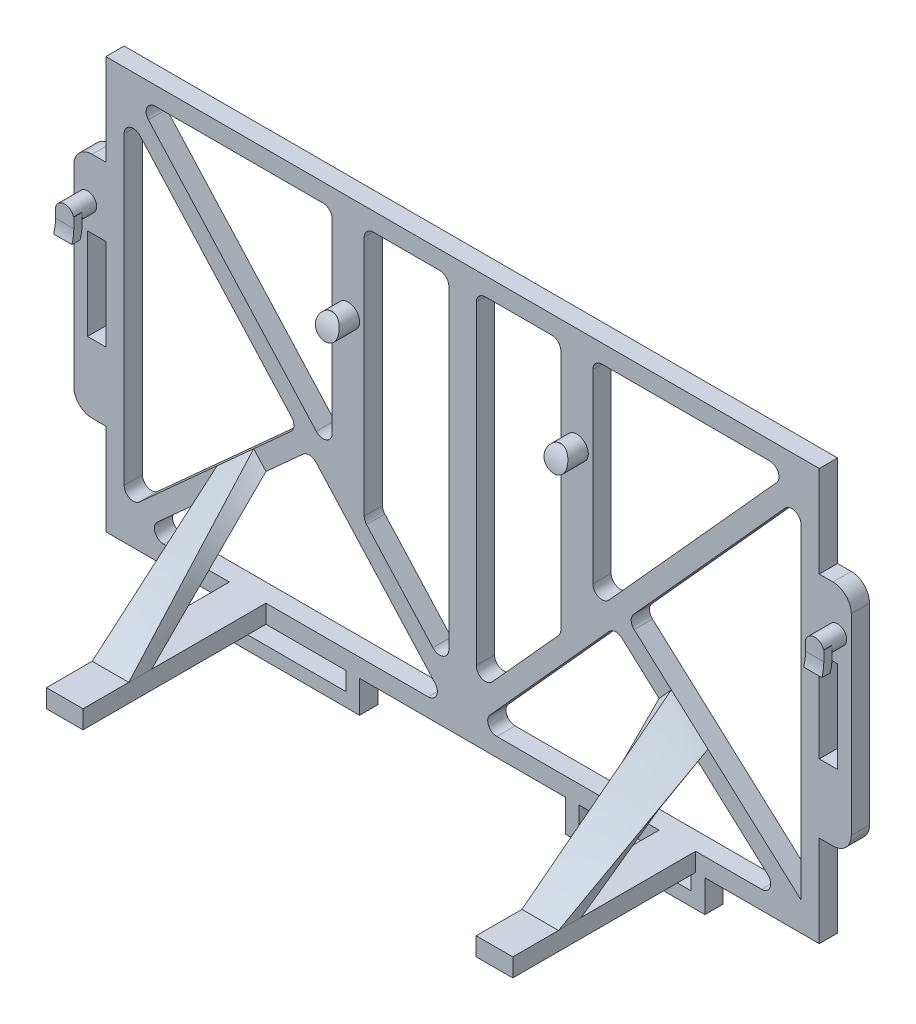
from build123d import *

# Parameters (mm, degrees)
SKETCH1_R               = 2.5
BOSS_EXTRUDE1_DEPTH     = 5
BOSS_EXTRUDE1_2_DEPTH   = 5
SKETCH1_R_2             = 2
BOSS_EXTRUDE1_3_DEPTH   = 5
BOSS_EXTRUDE1_4_DEPTH   = 5
SKETCH1_3_R             = 2.5
SKETCH1_3_R_2           = 2
SKETCH1_3_W             = 30.5
SKETCH1_3_H             = 7
BOSS_EXTRUDE2_DEPTH     = 4
SKETCH3_W               = 4
SKETCH3_H               = 1.8
BOSS_EXTRUDE4_DEPTH     = 2.5
BOSS_EXTRUDE4_2_DEPTH   = 2.5
CUT_EXTRUDE2_DEPTH      = 114.138189839
CUT_EXTRUDE2_DEPTH_BACK = 114.138189839
FILLET2_R               = 10
FILLET3_R               = 10
CUT_EXTRUDE1_DEPTH      = 185.759979433
CUT_EXTRUDE1_DEPTH_BACK = 185.759979433
BOSS_EXTRUDE6_DEPTH     = 4
FILLET4_R               = 10
CUT_EXTRUDE3_DEPTH      = 114.156572942
CUT_EXTRUDE3_DEPTH_BACK = 114.156572942
SKETCH7_W               = 24.5
SKETCH7_H               = 4
SKETCH8_W               = 8
SKETCH8_H               = 4
BOSS_EXTRUDE7_DEPTH     = 40
FILLET5_R               = 4
FILLET6_R               = 2


with BuildPart() as part:
    # Sketch1 → Boss-Extrude1 (new body)
    with BuildSketch(Plane.XY):
        with Locations((-25, 0)):
            Circle(SKETCH1_R)
    extrude(amount=BOSS_EXTRUDE1_DEPTH)


with BuildPart() as body_2:
    # Sketch1 → Boss-Extrude1 2 (new body)
    with BuildSketch(Plane.XY):
        with Locations((25, 0)):
            Circle(SKETCH1_R)
    extrude(amount=BOSS_EXTRUDE1_2_DEPTH)


with BuildPart() as body_3:
    # Sketch1 → Boss-Extrude1 3 (new body)
    with BuildSketch(Plane.XY):
        with Locations((82, -6.916)):
            Circle(SKETCH1_R_2)
    extrude(amount=BOSS_EXTRUDE1_3_DEPTH)


with BuildPart() as body_4:
    # Sketch1 → Boss-Extrude1 4 (new body)
    with BuildSketch(Plane.XY):
        with Locations((-82, -6.916)):
            Circle(SKETCH1_R_2)
    extrude(amount=BOSS_EXTRUDE1_4_DEPTH)


with BuildPart() as body_5:
    # Sketch1<3> → Boss-Extrude2 (new body)
    # profile 1 of 9: a face of its own
    with BuildSketch(Plane.XY):
        Polygon((-78, 2.5), (-78, -12.5), (-78, -32.5), (-78, -47.5), (-78, -67.5), (-53, -67.5), (-50, -67.5), (-25.5, -67.5), (-22.5, -67.5), (22.5, -67.5), (25.5, -67.5), (50, -67.5), (53, -67.5), (78, -67.5), (78, -47.5), (78, -32.5), (78, -12.5), (78, 2.5), (78, 22.5), (-78, 22.5), align=None)
        with Locations((-25, 0)):
            Circle(SKETCH1_3_R, mode=Mode.SUBTRACT)
        with Locations((25, 0)):
            Circle(SKETCH1_3_R, mode=Mode.SUBTRACT)
    # profile 2 of 9: a face of its own
    with BuildSketch(Plane.XY):
        Polygon((85, 2.5), (78, 2.5), (78, -12.5), (82, -12.5), (82, -32.5), (78, -32.5), (78, -47.5), (85, -47.5), align=None)
        with Locations((82, -6.916)):
            Circle(SKETCH1_3_R_2, mode=Mode.SUBTRACT)
    # profile 3 of 9: a face of its own
    with BuildSketch(Plane.XY):
        Polygon((-82, -32.5), (-82, -12.5), (-78, -12.5), (-78, 2.5), (-85, 2.5), (-85, -47.5), (-78, -47.5), (-78, -32.5), align=None)
        with Locations((-82, -6.916)):
            Circle(SKETCH1_3_R_2, mode=Mode.SUBTRACT)
    # profile 4 of 9: a face of its own
    with BuildSketch(Plane.XY):
        with Locations((82, -6.916)):
            Circle(SKETCH1_3_R_2)
    # profile 5 of 9: a face of its own
    with BuildSketch(Plane.XY):
        with Locations((25, 0)):
            Circle(SKETCH1_3_R)
    # profile 6 of 9: a face of its own
    with BuildSketch(Plane.XY):
        with Locations((-25, 0)):
            Circle(SKETCH1_3_R)
    # profile 7 of 9: a face of its own
    with BuildSketch(Plane.XY):
        with Locations((-82, -6.916)):
            Circle(SKETCH1_3_R_2)
    # profile 8 of 9: a face of its own
    with BuildSketch(Plane.XY):
        with Locations((-37.75, -71)):
            Rectangle(SKETCH1_3_W, SKETCH1_3_H)
    # profile 9 of 9: a face of its own
    with BuildSketch(Plane.XY):
        with Locations((37.75, -71)):
            Rectangle(SKETCH1_3_W, SKETCH1_3_H)
    extrude(amount=-BOSS_EXTRUDE2_DEPTH)


with BuildPart() as body_6:
    # Sketch3 → Boss-Extrude4 (new, symmetric)
    with BuildSketch(Plane(origin=(0, -8.916, 0), x_dir=(-1, 0, 0), z_dir=(0, -1, 0))):
        with Locations((82, -4.1)):
            Rectangle(SKETCH3_W, SKETCH3_H)
    extrude(amount=BOSS_EXTRUDE4_DEPTH, both=True)


with BuildPart() as body_7:
    # Sketch3 → Boss-Extrude4 2 (new, symmetric)
    with BuildSketch(Plane(origin=(0, -8.916, 0), x_dir=(-1, 0, 0), z_dir=(0, -1, 0))):
        with Locations((-82, -4.1)):
            Rectangle(SKETCH3_W, SKETCH3_H)
    extrude(amount=BOSS_EXTRUDE4_2_DEPTH, both=True)


with BuildPart() as cut_extrude2_tool:
    # Sketch6 → Cut-Extrude2 (new, two sides: drawn at the far end of the back side and taken through both)
    with BuildSketch(Plane(origin=(0, 0, 0), x_dir=(0, 0, -1), z_dir=(1, 0, 0)).offset(-CUT_EXTRUDE2_DEPTH_BACK)):
        Polygon((-3.5, 2.5), (-5, 0), (-5, 2.5), align=None)
    extrude(amount=CUT_EXTRUDE2_DEPTH + CUT_EXTRUDE2_DEPTH_BACK)


with BuildPart() as part_1:
    add(part.part)

    # Cut-Extrude2: cut by cut_extrude2_tool
    add(cut_extrude2_tool.part, mode=Mode.SUBTRACT)


with BuildPart() as body_2_1:
    add(body_2.part)

    # Cut-Extrude2: cut by cut_extrude2_tool
    add(cut_extrude2_tool.part, mode=Mode.SUBTRACT)

    # Fillet2
    # the kernel refuses this fillet: 10 mm, written as the material it takes off along each edge
    with BuildSketch(Plane(origin=(34.424599124, 0, 5), x_dir=(0, -1, 0), z_dir=(-1, 0, 0))) as fillet2_piece_1:
        with BuildLine():
            CenterArc((FILLET2_R * 0.276983964948, -FILLET2_R), FILLET2_R, 90, 30.963756532)
            Line((-FILLET2_R * 0.237511790479, -FILLET2_R * 0.142507074287), (0, 0))
            Line((0, 0), (FILLET2_R * 0.276983964948, 0))
        make_face()
    extrude(amount=18.849198247, mode=Mode.SUBTRACT)


with BuildPart() as body_4_1:
    add(body_4.part)

    # Combine1: union part, body 6, body 2, body 5, body 3, body 7
    add(part_1.part)
    add(body_6.part)
    add(body_2_1.part)
    add(body_5.part)
    add(body_3.part)
    add(body_7.part)

    # Fillet3
    # the kernel refuses this fillet: 10 mm, written as the material it takes off along each edge
    with BuildSketch(Plane(origin=(-15.575400876, 0, 5), x_dir=(0, 0.857492925712544, -0.5144957554275267), z_dir=(-1, 0, 0))) as fillet3_piece_1:
        with BuildLine():
            CenterArc((FILLET3_R * 0.276983964948, FILLET3_R), FILLET3_R, 239.036243468, 30.963756532)
            Line((-FILLET3_R * 0.237511790479, FILLET3_R * 0.142507074287), (0, 0))
            Line((0, 0), (FILLET3_R * 0.276983964948, 0))
        make_face()
    extrude(amount=18.849198247, mode=Mode.SUBTRACT)

    # Sketch5 → Cut-Extrude1 (cut, two sides: drawn at the far end of the back side and taken through both)
    with BuildSketch(Plane.ZY.offset(84).offset(-CUT_EXTRUDE1_DEPTH_BACK)):
        Polygon((3.6, -11.416), (3.2, -10.216), (3.2, -11.416), align=None)
    extrude(amount=CUT_EXTRUDE1_DEPTH + CUT_EXTRUDE1_DEPTH_BACK, mode=Mode.SUBTRACT)

    # Sketch5<4> → Boss-Extrude6 (add)
    with BuildSketch(Plane.ZY.offset(84)):
        Polygon((5, -10.216), (3.2, -10.216), (3.6, -11.416), (5, -11.416), align=None)
        Polygon((5.4, -11.416), (5, -10.216), (5, -11.416), align=None)
    boss_extrude6 = extrude(amount=-BOSS_EXTRUDE6_DEPTH)

    # Mirror6: Boss-Extrude6 across plane
    add(boss_extrude6.mirror(Plane(origin=(0, 0, 0), x_dir=(0, 0, 1), z_dir=(1, 0, 0))))

    # Fillet4
    # the kernel refuses this fillet: 10 mm, written as the material it adds along each edge
    with BuildSketch(Plane(origin=(-84, -10.216, 5), x_dir=(0, -0.9486832980505135, 0.31622776601683833), z_dir=(1, 0, 0))) as fillet4_piece_1_section:
        with BuildLine():
            CenterArc((1.644384383, -9.992797406), FILLET4_R, 92.174744115, 16.260204708)
            Line((-1.517893277, -0.505964426), (-1.58113883, -0.316227766))
            Line((-1.58113883, -0.316227766), (-0.063245553, 0.18973666))
            Line((-0.063245553, 0.18973666), (0, 0.2))
            ThreePointArc((0, 0.2), (0.632455532, 0.2), (1.257321598, 0.199855948))
            Line((1.257321598, 0.199855948), (1.264911064, 0))
        make_face()
    fillet4_piece_1 = extrude(amount=4, mode=Mode.PRIVATE)
    fillet4_piece_1 = split(fillet4_piece_1, bisect_by=Plane(origin=(-84, -11.416, 5), z_dir=(0, 1, 0)), keep=Keep.TOP, mode=Mode.PRIVATE)
    add(fillet4_piece_1)
    with BuildSketch(Plane(origin=(84, -10.216, 5), x_dir=(0, -0.9486832980505135, 0.31622776601683833), z_dir=(-1, 0, 0))) as fillet4_piece_2_section:
        with BuildLine():
            CenterArc((1.644384383, 9.992797406), FILLET4_R, 251.565051177, 16.260204708)
            Line((-1.517893277, 0.505964426), (-1.58113883, 0.316227766))
            Line((-1.58113883, 0.316227766), (-0.063245553, -0.18973666))
            Line((-0.063245553, -0.18973666), (0, -0.2))
            ThreePointArc((0, -0.2), (0.632455532, -0.2), (1.257321598, -0.199855948))
            Line((1.257321598, -0.199855948), (1.264911064, 0))
        make_face()
    fillet4_piece_2 = extrude(amount=4, mode=Mode.PRIVATE)
    fillet4_piece_2 = split(fillet4_piece_2, bisect_by=Plane(origin=(84, -11.416, 5), z_dir=(0, 1, 0)), keep=Keep.TOP, mode=Mode.PRIVATE)
    add(fillet4_piece_2)
    # the kernel refuses this fillet: 10 mm, written as the material it takes off along each edge
    with BuildSketch(Plane(origin=(-76, -10.216, 3.2), x_dir=(0, -0.9486832980505138, 0.31622776601683816), z_dir=(-1, 0, 0))) as fillet4_2_piece_1_section:
        with BuildLine():
            CenterArc((1.644384383, 9.992797406), FILLET4_R, 251.565051177, 16.260204708)
            Line((-1.517893277, 0.505964426), (-1.58113883, 0.316227766))
            Line((-1.58113883, 0.316227766), (-0.063245553, -0.18973666))
            Line((-0.063245553, -0.18973666), (0, -0.2))
            ThreePointArc((0, -0.2), (0.632455532, -0.2), (1.257321598, -0.199855948))
            Line((1.257321598, -0.199855948), (1.264911064, 0))
        make_face()
    fillet4_2_piece_1 = extrude(amount=12, mode=Mode.PRIVATE)
    fillet4_2_piece_1 = fillet4_2_piece_1 - Plane(origin=(-82, -6.916, 3.2), x_dir=(1, 0, 0), z_dir=(0, 0, -1)) * Cylinder(2, 31, mode=Mode.PRIVATE)
    add(fillet4_2_piece_1, mode=Mode.SUBTRACT)
    with BuildSketch(Plane(origin=(88, -10.216, 3.2), x_dir=(0, -0.9486832980505138, 0.31622776601683816), z_dir=(-1, 0, 0))) as fillet4_2_piece_2_section:
        with BuildLine():
            CenterArc((1.644384383, 9.992797406), FILLET4_R, 251.565051177, 16.260204708)
            Line((-1.517893277, 0.505964426), (-1.58113883, 0.316227766))
            Line((-1.58113883, 0.316227766), (-0.063245553, -0.18973666))
            Line((-0.063245553, -0.18973666), (0, -0.2))
            ThreePointArc((0, -0.2), (0.632455532, -0.2), (1.257321598, -0.199855948))
            Line((1.257321598, -0.199855948), (1.264911064, 0))
        make_face()
    fillet4_2_piece_2 = extrude(amount=12, mode=Mode.PRIVATE)
    fillet4_2_piece_2 = fillet4_2_piece_2 - Plane(origin=(82, -6.916, 3.2), x_dir=(1, 0, 0), z_dir=(0, 0, -1)) * Cylinder(2, 31, mode=Mode.PRIVATE)
    add(fillet4_2_piece_2, mode=Mode.SUBTRACT)

    # Sketch7 → Cut-Extrude3 (cut, two sides: drawn at the far end of the back side and taken through both)
    with BuildSketch(Plane.XY.offset(-CUT_EXTRUDE3_DEPTH_BACK)):
        Polygon((-36.055840536, -26.910896097), (-74, 15.08902799), (-74, -61.190939901), align=None)
        Polygon((-28.5, 18.5), (-71.690939901, 18.5), (-28.5, -29.307520912), align=None)
        Polygon((-3, 18.5), (-21.5, 18.5), (-21.5, -37.055734939), (-3, -57.533157725), align=None)
        Polygon((-33.37435521, -29.878999271), (-70.58902799, -63.5), (-3, -63.5), align=None)
        with Locations((-37.75, -69.5)):
            Rectangle(SKETCH7_W, SKETCH7_H)
        with Locations((37.75, -69.5)):
            Rectangle(SKETCH7_W, SKETCH7_H)
        Polygon((33.37435521, -29.878999271), (3, -63.5), (70.58902799, -63.5), align=None)
        Polygon((3, -57.533157725), (21.5, -37.055734939), (21.5, 18.5), (3, 18.5), align=None)
        Polygon((71.690939901, 18.5), (28.5, 18.5), (28.5, -29.307520912), align=None)
        Polygon((74, 15.08902799), (36.055840536, -26.910896097), (74, -61.190939901), align=None)
    extrude(amount=CUT_EXTRUDE3_DEPTH + CUT_EXTRUDE3_DEPTH_BACK, mode=Mode.SUBTRACT)

    # Sketch8 → Boss-Extrude7 (add)
    with BuildSketch(Plane.XY):
        with Locations((-46.983385512, -65.5)):
            Rectangle(SKETCH8_W, SKETCH8_H)
        with Locations((46.983385512, -65.5)):
            Rectangle(SKETCH8_W, SKETCH8_H)
    extrude(amount=BOSS_EXTRUDE7_DEPTH)

    # Loft3: read off the stored shape, not the designer's step
    # Loft3: loft between two sections, ruled curve by curve
    loft3_from = [
        Edge.make_bspline([(-50.983385512, -63.5, 30), (-49.650052179, -63.5, 30), (-48.316718845, -63.5, 30), (-45.650052179, -63.5, 30), (-44.316718845, -63.5, 30), (-42.983385512, -63.5, 30)], [0, 0, 0, 0, 0.5, 0.5, 1, 1, 1, 1], 3),
        Edge.make_bspline([(-42.983385512, -63.5, 30), (-42.983385512, -63.5, 29.166666667), (-42.983385512, -63.5, 28.333333333), (-42.983385512, -63.5, 26.666666667), (-42.983385512, -63.5, 25.833333333), (-42.983385512, -63.5, 25)], [0, 0, 0, 0, 0.5, 0.5, 1, 1, 1, 1], 3),
        Edge.make_bspline([(-50.983385512, -63.5, 25), (-50.983385512, -63.5, 25.833333333), (-50.983385512, -63.5, 26.666666667), (-50.983385512, -63.5, 28.333333333), (-50.983385512, -63.5, 29.166666667), (-50.983385512, -63.5, 30)], [0, 0, 0, 0, 0.5, 0.5, 1, 1, 1, 1], 3),
        Edge.make_bspline([(-42.983385512, -63.5, 25), (-44.316718845, -63.5, 25), (-45.650052179, -63.5, 25), (-48.316718845, -63.5, 25), (-49.650052179, -63.5, 25), (-50.983385512, -63.5, 25)], [0, 0, 0, 0, 0.5, 0.5, 1, 1, 1, 1], 3),
    ]
    loft3_to = [
        Edge.make_bspline([(-53.664870838, -42.819492798, 0), (-52.331537504, -41.61491413, 0), (-50.998204171, -40.410335462, 0), (-48.331537504, -38.001178126, 0), (-46.998204171, -36.796599458, 0), (-45.664870838, -35.59202079, 0)], [0, 0, 0, 0, 0.5, 0.5, 1, 1, 1, 1], 3),
        Edge.make_bspline([(-45.664870838, -35.59202079, 0), (-45.217956617, -36.086704652, 0), (-44.771042396, -36.581388514, 0), (-43.877213954, -37.570756239, 0), (-43.430299733, -38.065440101, 0), (-42.983385512, -38.560123963, 0)], [0, 0, 0, 0, 0.5, 0.5, 1, 1, 1, 1], 3),
        Edge.make_bspline([(-50.983385512, -45.787595972, 0), (-51.430299733, -45.29291211, 0), (-51.877213954, -44.798228247, 0), (-52.771042396, -43.808860523, 0), (-53.217956617, -43.314176661, 0), (-53.664870838, -42.819492798, 0)], [0, 0, 0, 0, 0.5, 0.5, 1, 1, 1, 1], 3),
        Edge.make_bspline([(-42.983385512, -38.560123963, 0), (-44.316718845, -39.764702631, 0), (-45.650052179, -40.969281299, 0), (-48.316718845, -43.378438636, 0), (-49.650052179, -44.583017304, 0), (-50.983385512, -45.787595972, 0)], [0, 0, 0, 0, 0.5, 0.5, 1, 1, 1, 1], 3),
    ]
    loft3 = Solid(Shell([*[Face.make_surface_from_curves(loft3_from[k], loft3_to[k]) for k in range(4)], Face(Wire(loft3_from)), Face(Wire(loft3_to))]))
    add(loft3)

    # Mirror7: Loft3 across plane
    add(loft3.mirror(Plane(origin=(0, 0, 0), x_dir=(0, 0, 1), z_dir=(1, 0, 0))))

    # Fillet5
    fillet5_edges = [body_4_1.edges().sort_by_distance(p)[0] for p in [
        (-85, 2.5, -2),
        (-85, -47.5, -2),
        (85, -47.5, -2),
        (85, 2.5, -2),
    ]]
    fillet(fillet5_edges, radius=FILLET5_R)

    # Fillet6
    fillet6_edges = [body_4_1.edges().sort_by_distance(p)[0] for p in [
        (33.37435521, -29.878999271, -2),
        (28.5, 18.5, -2),
        (74, 15.08902799, -2),
        (71.690939901, 18.5, -2),
        (21.5, 18.5, -2),
        (-21.5, 18.5, -2),
        (3, 18.5, -2),
        (28.5, -29.307520912, -2),
        (36.055840536, -26.910896097, -2),
        (3, -63.5, -2),
        (3, -57.533157725, -2),
        (-21.5, -37.055734939, -2),
        (21.5, -37.055734939, -2),
        (70.58902799, -63.5, -2),
        (-3, -63.5, -2),
        (-74, -61.190939901, -2),
        (-70.58902799, -63.5, -2),
        (-74, 15.08902799, -2),
        (-71.690939901, 18.5, -2),
        (-33.37435521, -29.878999271, -2),
        (-28.5, 18.5, -2),
        (-3, 18.5, -2),
        (-3, -57.533157725, -2),
        (-28.5, -29.307520912, -2),
        (-36.055840536, -26.910896097, -2),
    ]]
    fillet(fillet6_edges, radius=FILLET6_R)


solid = body_4_1.part
